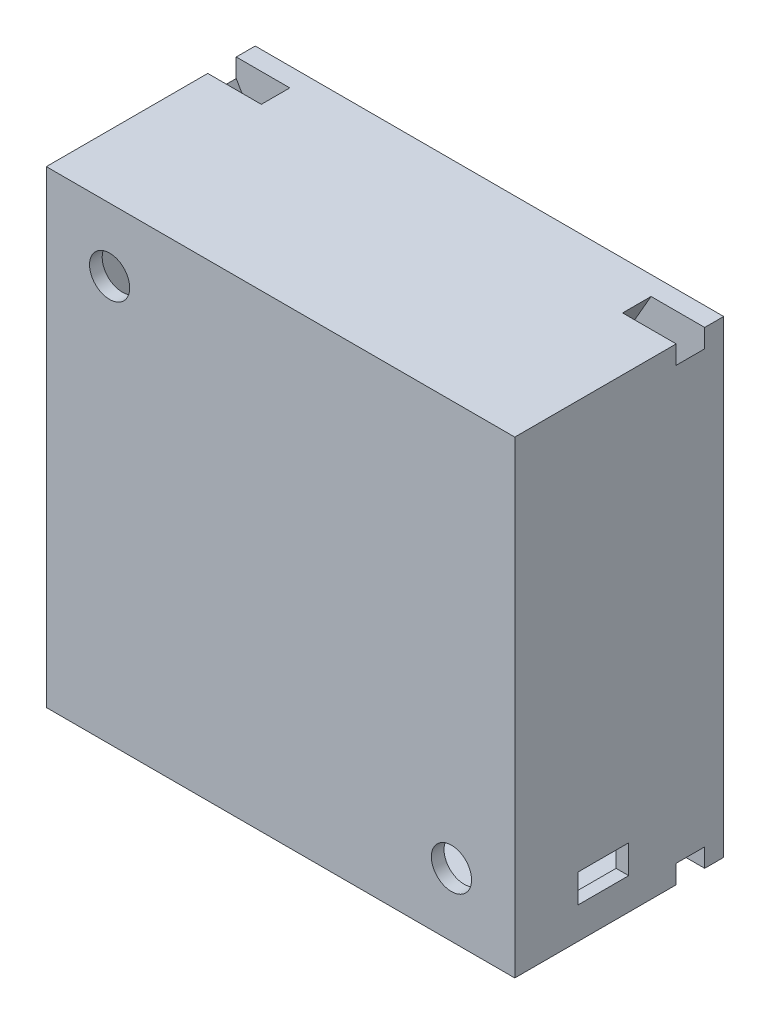
from build123d import *

# Parameters (mm, degrees)
SKETCH1_W           = 74
SKETCH1_H           = 74
BOSS_EXTRUDE1_DEPTH = 25
SHELL1_T            = -2
SKETCH2_W           = 8
SKETCH2_H           = 4.5
CUT_EXTRUDE1_DEPTH  = 22
SKETCH3_R           = 3.175
CUT_EXTRUDE2_DEPTH  = 108.596468344
SKETCH4_W           = 74
SKETCH4_H           = 74
BOSS_EXTRUDE2_DEPTH = 8
CUT_EXTRUDE3_START  = -3
CUT_EXTRUDE3_DEPTH  = 4.5
SKETCH6_W           = 45
SKETCH6_H           = 45
CUT_EXTRUDE4_DEPTH  = 8
CUT_EXTRUDE10_START = -1
CUT_EXTRUDE10_DEPTH = 1
SKETCH5_4_R         = 2
CUT_EXTRUDE11_DEPTH = 9


# Read off the part's stored shape, not the designer's step: Cut-Extrude10
with BuildPart() as part:
    # Sketch1 → Boss-Extrude1 (new body)
    with BuildSketch(Plane.XY):
        with Locations((37, 37)):
            Rectangle(SKETCH1_W, SKETCH1_H)
    extrude(amount=BOSS_EXTRUDE1_DEPTH)

    # Shell1
    shell1_openings = [part.faces().sort_by_distance(p)[0] for p in [
        (37, 37, 0),
    ]]
    offset(amount=SHELL1_T, openings=shell1_openings, kind=Kind.INTERSECTION)

    # Sketch2 → Cut-Extrude1 (cut)
    with BuildSketch(Plane(origin=(74, 0, 0), x_dir=(0, 0, -1), z_dir=(1, 0, 0))):
        with Locations((-11, 7.25)):
            Rectangle(SKETCH2_W, SKETCH2_H)
    extrude(amount=-CUT_EXTRUDE1_DEPTH, mode=Mode.SUBTRACT)

    # Sketch3 → Cut-Extrude2 (cut, through all)
    with BuildSketch(Plane.XY.offset(25)):
        with Locations((10, 64)):
            Circle(SKETCH3_R)
        with Locations((64, 10)):
            Circle(SKETCH3_R)
    extrude(amount=-CUT_EXTRUDE2_DEPTH, mode=Mode.SUBTRACT)

    # Sketch4 → Boss-Extrude2 (add)
    with BuildSketch(Plane(origin=(0, 0, 0), x_dir=(-1, 0, 0), z_dir=(0, 0, -1))):
        with Locations((-37, 37)):
            Rectangle(SKETCH4_W, SKETCH4_H)
    extrude(amount=BOSS_EXTRUDE2_DEPTH)

    # Sketch5 → Cut-Extrude3 (cut)
    with BuildSketch(Plane(origin=(0, 0, -8), x_dir=(-1, 0, 0), z_dir=(0, 0, -1)).offset(CUT_EXTRUDE3_START)):
        Polygon((-60.919317631, 8), (-63.459658816, 12.4), (-68.540341184, 12.4), (-74.568746864, 1.958495074), (-74.568746864, -0.972282173), (-66.099467159, -0.972282173), align=None)
        Polygon((-63.463624712, 61.59771267), (-60.919319694, 65.995421768), (-65.802792889, 74.471475085), (-74.465371111, 74.471475085), (-74.465371111, 71.879253606), (-68.544305018, 61.602290902), align=None)
        Polygon((-5.459702524, 61.599974765), (0.703595557, 72.274875291), (0.703595557, 74.471475085), (-8.189590882, 74.471475085), (-13.080682369, 66.00005047), (-10.540384893, 61.600025235), align=None)
        Polygon((-10.540490231, 12.399913945), (-13.080682366, 7.999827894), (-7.995582963, -0.807133653), (0.571776258, -0.807133653), (0.571776258, 1.953893119), (-5.459807865, 12.40008605), align=None)
    extrude(amount=-CUT_EXTRUDE3_DEPTH, mode=Mode.SUBTRACT)

    # Sketch6 → Cut-Extrude4 (cut)
    with BuildSketch(Plane(origin=(0, 0, -8), x_dir=(-1, 0, 0), z_dir=(0, 0, -1))):
        with Locations((-37, 37)):
            Rectangle(SKETCH6_W, SKETCH6_H)
    extrude(amount=-CUT_EXTRUDE4_DEPTH, mode=Mode.SUBTRACT)

    # Cut-Extrude10 outline → Cut-Extrude10 (cut)
    with BuildSketch(Plane.XZ.offset(CUT_EXTRUDE10_START)):
        with BuildLine():
            add(Edge.make_bspline(
                [(12.244921875, 14.608337696), (12.22296299, 14.60920838), (12.179368061, 14.610936947), (12.115469745, 14.625798621), (12.053855992, 14.648733433), (12.016469754, 14.671753524), (11.99765625, 14.683337696)],
                knots=[0, 0, 0, 0, 0.251074868, 0.498458438, 0.747614234, 1, 1, 1, 1], degree=3))
            add(Edge.make_bspline(
                [(12.45, 14.828650196), (12.44810186, 14.799147003), (12.444554554, 14.744010497), (12.402329284, 14.672042766), (12.332334145, 14.623910287), (12.275809653, 14.613840387), (12.244921875, 14.608337696)],
                knots=[0, 0, 0, 0, 0.262135661, 0.489887456, 0.721249278, 1, 1, 1, 1], degree=3))
            add(Edge.make_bspline(
                [(12.4078125, 14.970447071), (12.420108898, 14.947127329), (12.443588874, 14.902598273), (12.447931564, 14.852508226), (12.45, 14.828650196)],
                knots=[0, 0, 0, 0, 0.523697188, 1, 1, 1, 1], degree=3))
            Line((12.4078125, 14.970447071), (5.534765625, 21.851697071))
            Line((5.534765625, 21.851697071), (5.4609375, 21.882165821))
            add(Edge.make_bspline(
                [(5.1, 21.652478321), (5.101130742, 21.670561394), (5.103297124, 21.705206632), (5.119685049, 21.75396019), (5.149823147, 21.794252088), (5.190287736, 21.827525127), (5.242920358, 21.851708451), (5.305475941, 21.870670729), (5.379789996, 21.880316446), (5.432791747, 21.881524371), (5.4609375, 21.882165821)],
                knots=[0, 0, 0, 0, 0.112194147, 0.214952003, 0.313891338, 0.420689243, 0.536721732, 0.670960238, 0.825268571, 1, 1, 1, 1], degree=3))
            add(Edge.make_bspline(
                [(5.157421875, 21.525915821), (5.140627717, 21.547577619), (5.111281334, 21.585429794), (5.103379727, 21.632391539), (5.1, 21.652478321)],
                knots=[0, 0, 0, 0, 0.572273528, 1, 1, 1, 1], degree=3))
            Line((5.157421875, 21.525915821), (11.99765625, 14.683337696))
        make_face()
        with BuildLine():
            add(Edge.make_bspline(
                [(12.830859375, 16.332165821), (12.806611722, 16.332880637), (12.760653103, 16.334235487), (12.695606656, 16.343185504), (12.639038997, 16.359243561), (12.590419576, 16.382273546), (12.548696495, 16.410908541), (12.516703569, 16.448495353), (12.492316543, 16.491450489), (12.483699168, 16.523311237), (12.479296875, 16.539587696)],
                knots=[0, 0, 0, 0, 0.163241443, 0.30940526, 0.440897743, 0.557355848, 0.670469959, 0.778582052, 0.886885889, 1, 1, 1, 1], degree=3))
            Line((12.830859375, 16.332165821), (12.997265625, 16.332165821))
            add(Edge.make_bspline(
                [(13.065234375, 16.334509571), (13.054297092, 16.334112667), (13.031642253, 16.333290544), (13.008984624, 16.332549239), (12.997265625, 16.332165821)],
                knots=[0, 0, 0, 0, 0.482779122, 1, 1, 1, 1], degree=3))
            Line((13.065234375, 16.334509571), (13.15078125, 16.362634571))
            Line((13.15078125, 16.362634571), (13.454296875, 16.667322071))
            Line((13.454296875, 16.667322071), (13.491796875, 16.739978321))
            Line((13.491796875, 16.739978321), (13.5, 17.297790821))
            Line((13.5, 17.297790821), (13.5, 17.371618946))
            add(Edge.make_bspline(
                [(13.20234375, 17.944665821), (13.210597157, 17.929849426), (13.228545564, 17.897628712), (13.256314404, 17.845089826), (13.288074333, 17.78479063), (13.324465456, 17.717657372), (13.363157298, 17.642066218), (13.405143778, 17.558563248), (13.452185232, 17.468028061), (13.483699781, 17.404485145), (13.5, 17.371618946)],
                knots=[0, 0, 0, 0, 0.078785549, 0.171332276, 0.276048266, 0.395387691, 0.526054495, 0.670509549, 0.829578188, 1, 1, 1, 1], degree=3))
            Line((13.20234375, 17.944665821), (12.403125, 18.479040821))
            add(Edge.make_bspline(
                [(12.289453125, 18.507165821), (12.31084801, 18.5052121), (12.350224476, 18.501616352), (12.386540839, 18.486118184), (12.403125, 18.479040821)],
                knots=[0, 0, 0, 0, 0.543341929, 1, 1, 1, 1], degree=3))
            add(Edge.make_bspline(
                [(12.179296875, 18.494275196), (12.201126009, 18.497814185), (12.237664521, 18.503737892), (12.274588549, 18.506181923), (12.289453125, 18.507165821)],
                knots=[0, 0, 0, 0, 0.597428096, 1, 1, 1, 1], degree=3))
            add(Edge.make_bspline(
                [(12.005859375, 18.353650196), (12.012754805, 18.365403015), (12.028374155, 18.392025197), (12.067688375, 18.425310284), (12.117788217, 18.461646386), (12.157466096, 18.482694512), (12.179296875, 18.494275196)],
                knots=[0, 0, 0, 0, 0.179374527, 0.406314537, 0.673354122, 1, 1, 1, 1], degree=3))
            add(Edge.make_bspline(
                [(11.98828125, 18.276306446), (11.990007203, 18.287684739), (11.993981075, 18.31388238), (12.001567772, 18.339282172), (12.005859375, 18.353650196)],
                knots=[0, 0, 0, 0, 0.434325116, 1, 1, 1, 1], degree=3))
            add(Edge.make_bspline(
                [(12.084375, 18.115759571), (12.069768434, 18.129757216), (12.042992013, 18.155417378), (12.013246552, 18.197681646), (11.992279819, 18.236971695), (11.9895321, 18.264001579), (11.98828125, 18.276306446)],
                knots=[0, 0, 0, 0, 0.315523821, 0.578411003, 0.808079218, 1, 1, 1, 1], degree=3))
            Line((12.084375, 18.115759571), (12.778125, 17.652868946))
            Line((12.778125, 17.652868946), (12.975, 17.263806446))
            Line((12.975, 17.263806446), (12.975, 16.874743946))
            Line((12.975, 16.874743946), (12.891522636, 16.791266582))
            add(Edge.make_bspline(
                [(12.870703125, 16.792712696), (12.87764234, 16.792220225), (12.884581555, 16.791727755), (12.891522636, 16.791266582)],
                knots=[0, 0, 0, 0, 0.362748525, 0.362748525, 0.362748525, 0.362748525], degree=3))
            Line((12.870703125, 16.792712696), (12.805078125, 16.792712696))
            add(Edge.make_bspline(
                [(12.53671875, 16.698962696), (12.549147315, 16.713703314), (12.575814448, 16.745331261), (12.638752816, 16.772945663), (12.716162101, 16.790262491), (12.773683775, 16.791847581), (12.805078125, 16.792712696)],
                knots=[0, 0, 0, 0, 0.193970343, 0.416189066, 0.681365937, 1, 1, 1, 1], degree=3))
            add(Edge.make_bspline(
                [(12.479296875, 16.539587696), (12.481482036, 16.569008186), (12.48582524, 16.627484051), (12.51982501, 16.675235867), (12.53671875, 16.698962696)],
                knots=[0, 0, 0, 0, 0.503121942, 1, 1, 1, 1], degree=3))
        make_face()
    extrude(amount=CUT_EXTRUDE10_DEPTH, mode=Mode.SUBTRACT)

    # Sketch5<4> → Cut-Extrude11 (cut)
    with BuildSketch(Plane(origin=(0, 0, -8), x_dir=(-1, 0, 0), z_dir=(0, 0, -1))):
        with Locations((-66, 66)):
            Circle(SKETCH5_4_R)
        with Locations((-8, 66)):
            Circle(SKETCH5_4_R)
        with Locations((-8, 8)):
            Circle(SKETCH5_4_R)
        with Locations((-66, 8)):
            Circle(SKETCH5_4_R)
    extrude(amount=-CUT_EXTRUDE11_DEPTH, mode=Mode.SUBTRACT)


solid = part.part
